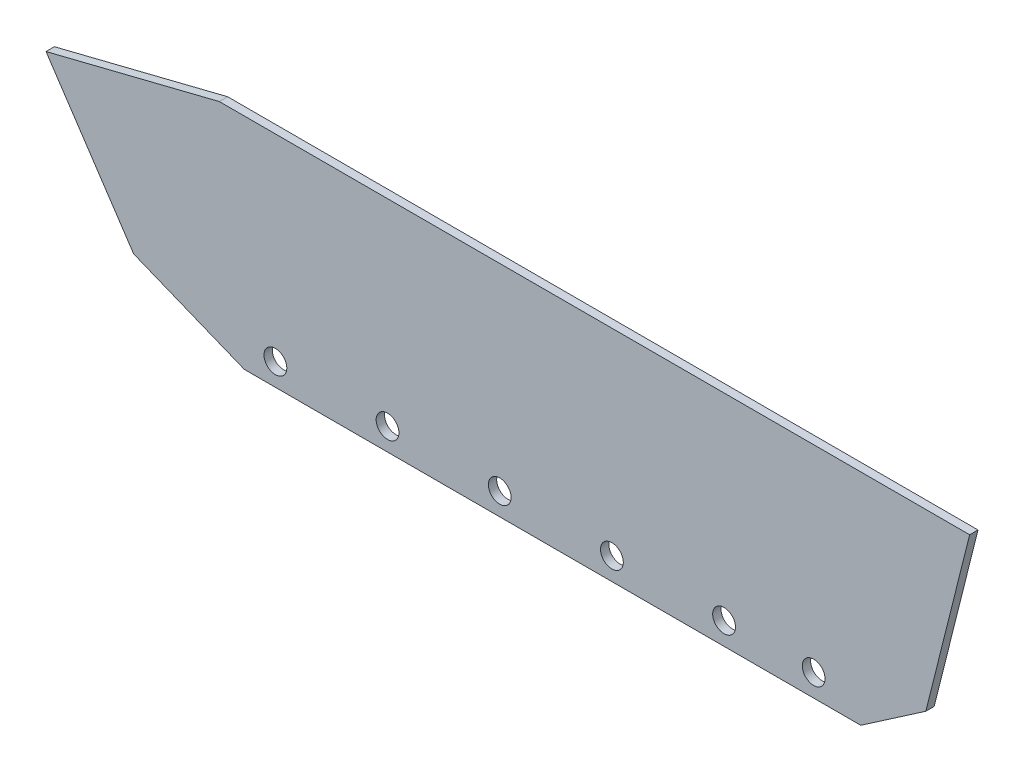
from build123d import *

# Parameters (mm, degrees)
BOSS_EXTRUDE1_DEPTH = 4.7625
SKETCH1_4_R         = 6.5
CUT_EXTRUDE1_DEPTH  = 439.920211962
CUT_EXTRUDE3_DEPTH  = 10


with BuildPart() as part:
    # Sketch1 → Boss-Extrude1 (new body)
    with BuildSketch(Plane.XY):
        Polygon((428.120588235, 28.570833333), (0, 28.570833333), (-98.879411765, 3.850980392), (-31.879411765, -96.649019608), (366, -96.649019608), (403.120588235, -71.149019608), align=None)
    extrude(amount=BOSS_EXTRUDE1_DEPTH)

    # Sketch1<4> → Cut-Extrude1 (cut, through all)
    with BuildSketch(Plane.XY):
        with Locations((32, -83.899019608)):
            Circle(SKETCH1_4_R)
        with Locations((96, -83.899019608)):
            Circle(SKETCH1_4_R)
        with Locations((160, -83.899019608)):
            Circle(SKETCH1_4_R)
        with Locations((224, -83.899019608)):
            Circle(SKETCH1_4_R)
        with Locations((288, -83.899019608)):
            Circle(SKETCH1_4_R)
        with Locations((339.120588235, -83.899019608)):
            Circle(SKETCH1_4_R)
    extrude(amount=CUT_EXTRUDE1_DEPTH, mode=Mode.SUBTRACT)

    # Sketch6 → Cut-Extrude3 (cut)
    with BuildSketch(Plane.XY.offset(4.7625)):
        Polygon((-48.879411765, -71.149019608), (14.235302997, -96.649019608), (-31.879411765, -96.649019608), align=None)
    extrude(amount=-CUT_EXTRUDE3_DEPTH, mode=Mode.SUBTRACT)


solid = part.part
